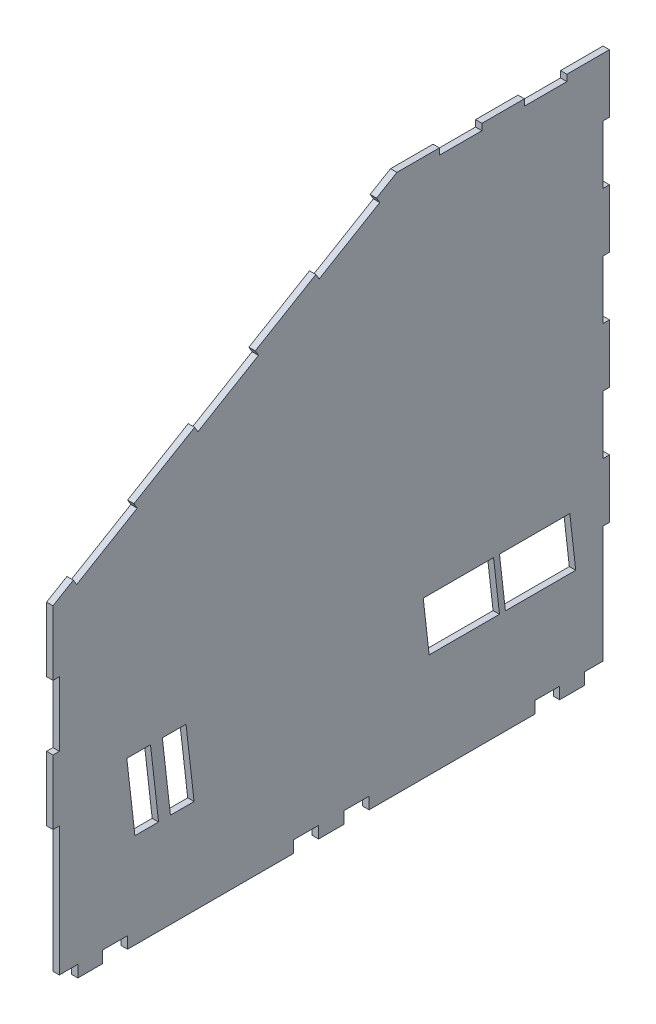
from build123d import *

# Parameters (mm, degrees)
BOSS_EXTRUDE1_DEPTH = 2.7


with BuildPart() as part:
    # Sketch1 → Boss-Extrude1 (new body)
    with BuildSketch(Plane(origin=(0, 0, 0), x_dir=(0, 0, -1), z_dir=(1, 0, 0))):
        Polygon((117.52, 87.8), (117.52, 112.5), (99.566, 112.5), (99.566, 109.8), (81.612, 109.8), (81.612, 112.5), (63.658, 112.5), (63.658, 109.8), (45.704, 109.8), (45.704, 112.5), (27.75, 112.5), (19.142256818, 107.410131897), (20.516521206, 105.086041238), (-5.094381521, 89.941988479), (-6.468645909, 92.266079138), (-32.079548636, 77.122026379), (-30.705284249, 74.79793572), (-56.316186976, 59.653882961), (-57.690451364, 61.977973621), (-83.301354091, 46.833920862), (-81.927089703, 44.509830203), (-107.53799243, 29.365777444), (-108.912256818, 31.689868103), (-117.52, 26.6), (-117.52, -0.68), (-114.82, -0.68), (-114.82, -27.96), (-117.52, -27.96), (-117.52, -55.24), (-114.82, -55.24), (-114.82, -82.52), (-114.82, -109.8), (-107.013333333, -109.8), (-107.013333333, -112.5), (-107.013333333, -114.8), (-96.506666667, -114.8), (-96.506666667, -112.5), (-96.506666667, -109.8), (-86, -109.8), (-86, -112.5), (-86, -114.8), (-16, -114.8), (-16, -112.5), (-16, -109.8), (-5.333333333, -109.8), (-5.333333333, -112.5), (-5.333333333, -114.8), (5.333333333, -114.8), (5.333333333, -112.5), (5.333333333, -109.8), (16, -109.8), (16, -112.5), (16, -114.8), (86, -114.8), (86, -112.5), (86, -109.8), (96.506666667, -109.8), (96.506666667, -112.5), (96.506666667, -114.8), (107.013333333, -114.8), (107.013333333, -112.5), (107.013333333, -109.8), (114.82, -109.8), (114.82, -85.1), (114.82, -60.4), (117.52, -60.4), (117.52, -35.7), (114.82, -35.7), (114.82, -11), (117.52, -11), (117.52, 13.7), (114.82, 13.7), (114.82, 38.4), (117.52, 38.4), (117.52, 63.1), (114.82, 63.1), (114.82, 87.8), align=None)
        Polygon((-76.32, -44.8), (-72.910909091, -74.8), (-82.910909091, -74.8), (-86.32, -44.8), align=None, mode=Mode.SUBTRACT)
        Polygon((-62.910909091, -74.8), (-67.910909091, -74.8), (-71.32, -44.8), (-66.32, -44.8), (-61.32, -44.8), (-57.910909091, -74.8), align=None, mode=Mode.SUBTRACT)
        Polygon((41.38, -48.8), (68.58, -48.8), (71.08, -70.8), (41.38, -70.8), (38.88, -48.8), align=None, mode=Mode.SUBTRACT)
        Polygon((71.08, -48.8), (100.78, -48.8), (103.28, -70.8), (100.78, -70.8), (73.58, -70.8), align=None, mode=Mode.SUBTRACT)
    extrude(amount=BOSS_EXTRUDE1_DEPTH)


solid = part.part
